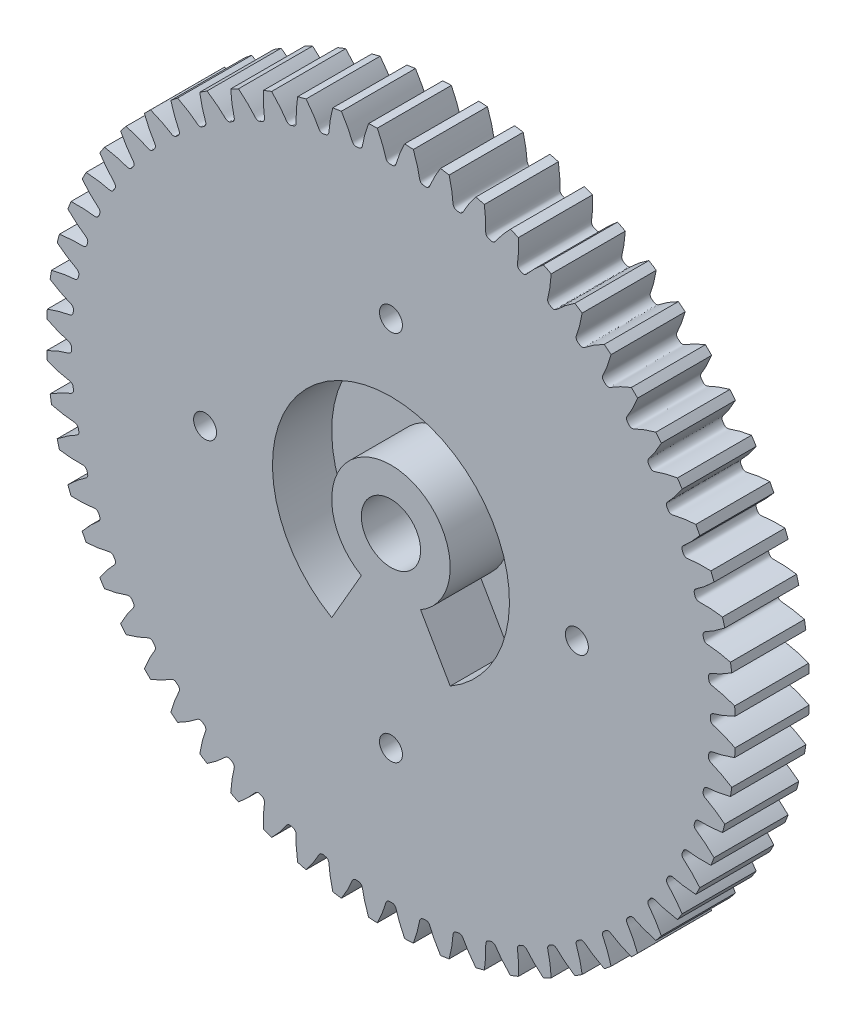
from build123d import *

# Parameters (mm, degrees)
SKETCHREVOLVESPURASSEMBLY01GEAR_W       = 10
SKETCHREVOLVESPURASSEMBLY01GEAR_H       = 46.499999302
TOOTHEXTRUDECUTSPURASSEMBLY01GEAR_DEPTH = 5
PATTERNSPURASSEMBLY01GEAR_COUNT         = 60
SKETCH5_R                               = 4
CUT_EXTRUDE2_DEPTH                      = 18
SKETCH6_R                               = 1.55
CUT_EXTRUDE3_DEPTH                      = 10
CIRPATTERN2_COUNT                       = 4
CUT_EXTRUDE4_DEPTH                      = 8
SKETCH7_R                               = 3.5
CUT_EXTRUDE5_DEPTH                      = 3


with BuildPart() as part:
    # SketchRevolveSpurAssembly01Gear → SpurAssembly01Gear (revolve)
    with BuildSketch(Plane(origin=(0, 0, 0), x_dir=(0, 0, -1), z_dir=(1, 0, 0))):
        with Locations((0, 23.249999651)):
            Rectangle(SKETCHREVOLVESPURASSEMBLY01GEAR_W, SKETCHREVOLVESPURASSEMBLY01GEAR_H)
    revolve(axis=Axis((0, 0, 0), (0, 0, -1)))

    # SketchToothSpurAssembly01Gear → ToothExtrudeCutSpurAssembly01Gear (cut, symmetric)
    with BuildSketch(Plane.XY):
        with BuildLine():
            ThreePointArc((46.536941888, 1.882445097), (46.574999301, 0), (46.536941888, -1.882445097))
            add(Edge.make_bspline(
                [(46.536941888, -1.882445097), (46.410580772, -1.817790323), (46.222345848, -1.724049646), (45.97247157, -1.604862074), (45.79126821, -1.520902479), (45.613955508, -1.441140119), (45.440604048, -1.365477285), (45.271282713, -1.293815196), (45.106058665, -1.226054069), (44.944997361, -1.162093066), (44.788162422, -1.101830604), (44.635616032, -1.045163354), (44.487417476, -0.991989937), (44.343628263, -0.942197901), (44.204293895, -0.895710038), (44.06950835, -0.852320586), (43.939186277, -0.812273822), (43.755364294, -0.756463501), (43.591162201, -0.718537687), (43.456933301, -0.660411719), (43.396978032, -0.628409971), (43.333262239, -0.585604909), (43.264730377, -0.524892475), (43.194956481, -0.436129591), (43.140009905, -0.315401482), (43.119097636, -0.163510161), (43.128214427, 0), (43.119097636, 0.163510161), (43.140009905, 0.315401482), (43.194956481, 0.436129591), (43.264730377, 0.524892475), (43.333262239, 0.585604909), (43.396978032, 0.628409971), (43.456933301, 0.660411719), (43.591162201, 0.718537687), (43.755364294, 0.756463501), (43.939186277, 0.812273822), (44.06950835, 0.852320586), (44.204293895, 0.895710038), (44.343628263, 0.942197901), (44.487417476, 0.991989937), (44.635616032, 1.045163354), (44.788162422, 1.101830604), (44.944997361, 1.162093066), (45.106058665, 1.226054069), (45.271282713, 1.293815196), (45.440604048, 1.365477285), (45.613955508, 1.441140119), (45.79126821, 1.520902479), (45.97247157, 1.604862074), (46.222345848, 1.724049646), (46.410580772, 1.817790323), (46.536941888, 1.882445097)],
                knots=[0, 0, 0, 0, 0.05176586, 0.076685537, 0.100963046, 0.124598386, 0.147591557, 0.16994256, 0.191651394, 0.21271806, 0.233142557, 0.252924885, 0.272065045, 0.290563036, 0.308418859, 0.325632513, 0.342203998, 0.358133315, 0.395728589, 0.403326908, 0.411414611, 0.420483419, 0.431260975, 0.444674611, 0.46138654, 0.478964563, 0.5, 0.521035437, 0.53861346, 0.555325389, 0.568739025, 0.579516581, 0.588585389, 0.596673092, 0.604271411, 0.641866685, 0.657796002, 0.674367487, 0.691581141, 0.709436964, 0.727934955, 0.747075115, 0.766857443, 0.78728194, 0.808348606, 0.83005744, 0.852408443, 0.875401614, 0.899036954, 0.923314463, 0.94823414, 1, 1, 1, 1], degree=3))
        make_face()
    toothextrudecutspurassembly01gear = extrude(amount=TOOTHEXTRUDECUTSPURASSEMBLY01GEAR_DEPTH, both=True, mode=Mode.SUBTRACT)

    # PatternSpurAssembly01Gear: ToothExtrudeCutSpurAssembly01Gear ×60 about axis
    patternspurassembly01gear_axis = Axis((0, 0, 5.5), (0, 0, -1))
    for i in range(1, PATTERNSPURASSEMBLY01GEAR_COUNT):
        add(toothextrudecutspurassembly01gear.rotate(patternspurassembly01gear_axis, i * 360 / PATTERNSPURASSEMBLY01GEAR_COUNT), mode=Mode.SUBTRACT)

    # Sketch5 → Cut-Extrude2 (cut)
    with BuildSketch(Plane(origin=(0, 0, -5), x_dir=(-1, 0, 0), z_dir=(0, 0, -1))):
        Circle(SKETCH5_R)
    extrude(amount=-CUT_EXTRUDE2_DEPTH, mode=Mode.SUBTRACT)

    # Sketch6 → Cut-Extrude3 (cut)
    with BuildSketch(Plane(origin=(0, 0, -5), x_dir=(-1, 0, 0), z_dir=(0, 0, -1))):
        with Locations((25.1, 0)):
            Circle(SKETCH6_R)
    cut_extrude3 = extrude(amount=-CUT_EXTRUDE3_DEPTH, mode=Mode.SUBTRACT)

    # CirPattern2: Cut-Extrude3 ×4 about axis
    cirpattern2_axis = Axis((0, 0, 5.5), (0, 0, -1))
    for i in range(1, CIRPATTERN2_COUNT):
        add(cut_extrude3.rotate(cirpattern2_axis, i * 360 / CIRPATTERN2_COUNT), mode=Mode.SUBTRACT)

    # Sketch4 → Cut-Extrude4 (cut)
    with BuildSketch(Plane.XY.offset(5)):
        with BuildLine():
            Line((-4, -6.92820323), (-8, -13.856406461))
            ThreePointArc((-8, -13.856406461), (0, 16), (8, -13.856406461))
            Line((8, -13.856406461), (4, -6.92820323))
            ThreePointArc((4, -6.92820323), (0, 8), (-4, -6.92820323))
        make_face()
    extrude(amount=-CUT_EXTRUDE4_DEPTH, mode=Mode.SUBTRACT)

    # Sketch7 → Cut-Extrude5 (cut)
    with BuildSketch(Plane(origin=(0, 0, -5), x_dir=(-1, 0, 0), z_dir=(0, 0, -1))):
        with Locations((-25.1, 0)):
            Circle(SKETCH7_R)
        with Locations((0, 25.1)):
            Circle(SKETCH7_R)
        with Locations((25.1, 0)):
            Circle(SKETCH7_R)
        with Locations((0, -25.1)):
            Circle(SKETCH7_R)
    extrude(amount=-CUT_EXTRUDE5_DEPTH, mode=Mode.SUBTRACT)


solid = part.part
